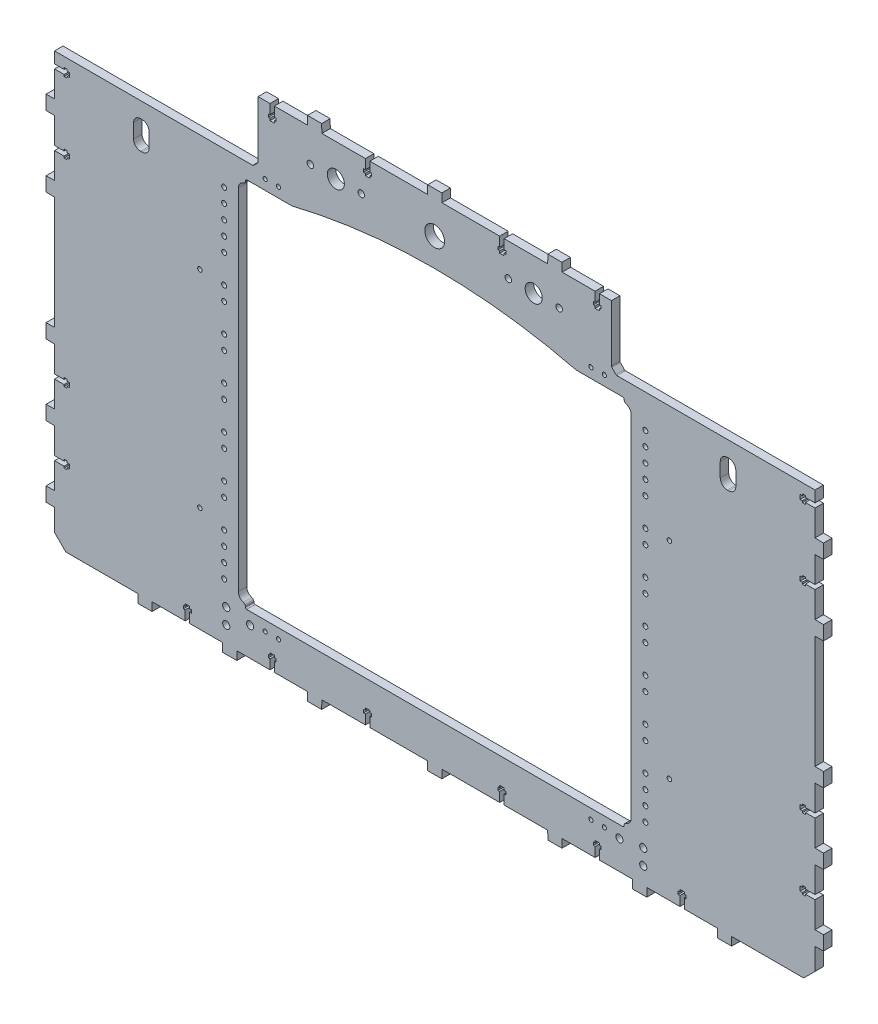
from build123d import *

# Parameters (mm, degrees)
SKETCH_1_R      = 1.6
SKETCH_1_R_2    = 1.75
SKETCH_1_R_3    = 2.55
SKETCH_1_R_4    = 1.5
SKETCH_1_R_5    = 2.3
SKETCH_1_R_6    = 6.05
SKETCH_1_R_7    = 7
EXTRUDE_1_DEPTH = 6


with BuildPart() as part:
    # Эскиз1 → Бобышка-Вытянуть1 (new body)
    with BuildSketch(Plane.XY):
        with BuildLine():
            Line((1433.580450761, 343.057239019), (1435.080450761, 343.057239019))
            Line((1435.080450761, 343.057239019), (1435.080450761, 339.95723902))
            Line((1435.080450761, 339.95723902), (1433.580450761, 339.95723902))
            Line((1433.580450761, 339.95723902), (1433.580450761, 338.75723902))
            Line((1433.580450761, 338.75723902), (1431.380450761, 338.75723902))
            Line((1431.380450761, 338.75723902), (1431.380450761, 339.95723902))
            Line((1431.380450761, 339.95723902), (1424.580450761, 339.95723902))
            Line((1424.580450761, 339.95723902), (1424.580450761, 321.60723902))
            Line((1424.580450761, 321.60723902), (1418.580450762, 321.50723902))
            Line((1418.580450762, 321.50723902), (1418.580450762, 311.50723902))
            Line((1418.580450762, 311.50723902), (1424.580450761, 311.407239019))
            Line((1424.580450761, 311.407239019), (1424.580450761, 293.05723902))
            Line((1424.580450761, 293.05723902), (1431.380450761, 293.05723902))
            Line((1431.380450761, 293.05723902), (1431.380450761, 294.25723902))
            Line((1431.380450761, 294.25723902), (1433.580450761, 294.25723902))
            Line((1433.580450761, 294.25723902), (1433.580450761, 293.05723902))
            Line((1433.580450761, 293.05723902), (1435.080450761, 293.05723902))
            Line((1435.080450761, 293.05723902), (1435.080450761, 289.95723902))
            Line((1435.080450761, 289.95723902), (1433.580450761, 289.95723902))
            Line((1433.580450761, 289.95723902), (1433.580450761, 288.75723902))
            Line((1433.580450761, 288.75723902), (1431.380450761, 288.75723902))
            Line((1431.380450761, 288.75723902), (1431.380450761, 289.95723902))
            Line((1431.380450761, 289.95723902), (1424.580450761, 289.95723902))
            Line((1424.580450761, 289.95723902), (1424.580450761, 271.60723902))
            Line((1424.580450761, 271.60723902), (1418.580450762, 271.50723902))
            Line((1418.580450762, 271.50723902), (1418.580450762, 261.50723902))
            Line((1418.580450762, 261.50723902), (1424.580450761, 261.407239019))
            Line((1424.580450761, 261.407239019), (1424.580450761, 181.60723902))
            Line((1424.580450761, 181.60723902), (1418.580450762, 181.50723902))
            Line((1418.580450762, 181.50723902), (1418.580450762, 171.50723902))
            Line((1418.580450762, 171.50723902), (1424.58045076, 171.407239019))
            Line((1424.58045076, 171.407239019), (1424.58045076, 153.05723902))
            Line((1424.58045076, 153.05723902), (1431.38045076, 153.05723902))
            Line((1431.38045076, 153.05723902), (1431.38045076, 154.257239019))
            Line((1431.38045076, 154.257239019), (1433.58045076, 154.257239019))
            Line((1433.58045076, 154.257239019), (1433.58045076, 153.057239019))
            Line((1433.58045076, 153.057239019), (1435.08045076, 153.057239019))
            Line((1435.08045076, 153.057239019), (1435.08045076, 149.957239019))
            Line((1435.08045076, 149.957239019), (1433.58045076, 149.957239019))
            Line((1433.58045076, 149.957239019), (1433.58045076, 148.757239019))
            Line((1433.58045076, 148.757239019), (1431.38045076, 148.757239019))
            Line((1431.38045076, 148.757239019), (1431.38045076, 149.957239019))
            Line((1431.38045076, 149.957239019), (1424.58045076, 149.957239019))
            Line((1424.58045076, 149.957239019), (1424.58045076, 131.607239019))
            Line((1424.58045076, 131.607239019), (1418.580450762, 131.507239019))
            Line((1418.580450762, 131.507239019), (1418.580450762, 121.507239019))
            Line((1418.580450762, 121.507239019), (1424.58045076, 121.407239018))
            Line((1424.58045076, 121.407239018), (1424.58045076, 103.057239019))
            Line((1424.58045076, 103.057239019), (1431.38045076, 103.057239019))
            Line((1431.38045076, 103.057239019), (1431.38045076, 104.257239019))
            Line((1431.38045076, 104.257239019), (1433.58045076, 104.257239019))
            Line((1433.58045076, 104.257239019), (1433.58045076, 103.057239019))
            Line((1433.58045076, 103.057239019), (1435.08045076, 103.057239019))
            Line((1435.08045076, 103.057239019), (1435.08045076, 99.957239019))
            Line((1435.08045076, 99.957239019), (1433.58045076, 99.957239019))
            Line((1433.58045076, 99.957239019), (1433.58045076, 98.757239019))
            Line((1433.58045076, 98.757239019), (1431.38045076, 98.757239019))
            Line((1431.38045076, 98.757239019), (1431.38045076, 99.957239019))
            Line((1431.38045076, 99.957239019), (1424.58045076, 99.957239019))
            Line((1424.58045076, 99.957239019), (1424.58045076, 81.607239019))
            Line((1424.58045076, 81.607239019), (1418.580450762, 81.507239019))
            Line((1418.580450762, 81.507239019), (1418.580450762, 71.507239019))
            Line((1418.580450762, 71.507239019), (1424.58045076, 71.407239018))
            Line((1424.58045076, 71.407239018), (1424.58045076, 56.007239019))
            Line((1424.58045076, 56.007239019), (1432.58045076, 48.007239019))
            Line((1432.58045076, 48.007239019), (1483.480450759, 48.007239019))
            Line((1483.480450759, 48.007239019), (1483.58045076, 42.00723902))
            Line((1483.58045076, 42.00723902), (1493.58045076, 42.00723902))
            Line((1493.58045076, 42.00723902), (1493.68045076, 48.007239019))
            Line((1493.68045076, 48.007239019), (1517.03045076, 48.007239019))
            Line((1517.03045076, 48.007239019), (1517.03045076, 54.807239019))
            Line((1517.03045076, 54.807239019), (1515.830450761, 54.807239019))
            Line((1515.830450761, 54.807239019), (1515.830450761, 57.007239019))
            Line((1515.830450761, 57.007239019), (1517.030450761, 57.007239019))
            Line((1517.030450761, 57.007239019), (1517.030450761, 58.507239019))
            Line((1517.030450761, 58.507239019), (1520.130450761, 58.507239019))
            Line((1520.130450761, 58.507239019), (1520.130450761, 57.007239019))
            Line((1520.130450761, 57.007239019), (1521.330450761, 57.007239019))
            Line((1521.330450761, 57.007239019), (1521.330450761, 54.807239019))
            Line((1521.330450761, 54.807239019), (1520.130450761, 54.807239019))
            Line((1520.130450761, 54.807239019), (1520.130450761, 48.007239019))
            Line((1520.130450761, 48.007239019), (1532.58045076, 48.007239019))
            Line((1532.58045076, 48.007239019), (1543.48045076, 48.007239019))
            Line((1543.48045076, 48.007239019), (1543.580450761, 42.00723902))
            Line((1543.580450761, 42.00723902), (1553.580450761, 42.00723902))
            Line((1553.580450761, 42.00723902), (1553.680450761, 48.007239018))
            Line((1553.680450761, 48.007239018), (1577.030450761, 48.007239018))
            Line((1577.030450761, 48.007239018), (1577.030450761, 54.807239018))
            Line((1577.030450761, 54.807239018), (1575.830450761, 54.807239018))
            Line((1575.830450761, 54.807239018), (1575.830450761, 57.007239018))
            Line((1575.830450761, 57.007239018), (1577.030450761, 57.007239018))
            Line((1577.030450761, 57.007239018), (1577.030450761, 58.507239018))
            Line((1577.030450761, 58.507239018), (1580.130450761, 58.507239018))
            Line((1580.130450761, 58.507239018), (1580.130450761, 57.007239018))
            Line((1580.130450761, 57.007239018), (1581.330450761, 57.007239018))
            Line((1581.330450761, 57.007239018), (1581.330450761, 54.807239018))
            Line((1581.330450761, 54.807239018), (1580.130450761, 54.807239018))
            Line((1580.130450761, 54.807239018), (1580.130450761, 48.007239018))
            Line((1580.130450761, 48.007239018), (1603.48045076, 48.007239018))
            Line((1603.48045076, 48.007239018), (1603.580450761, 42.007239019))
            Line((1603.580450761, 42.007239019), (1613.580450761, 42.007239019))
            Line((1613.580450761, 42.007239019), (1613.680450761, 48.007239017))
            Line((1613.680450761, 48.007239017), (1644.530450761, 48.007239017))
            Line((1644.530450761, 48.007239017), (1644.530450761, 54.807239017))
            Line((1644.530450761, 54.807239017), (1643.330450762, 54.807239017))
            Line((1643.330450762, 54.807239017), (1643.330450762, 57.007239017))
            Line((1643.330450762, 57.007239017), (1644.530450762, 57.007239017))
            Line((1644.530450762, 57.007239017), (1644.530450762, 58.507239017))
            Line((1644.530450762, 58.507239017), (1647.630450762, 58.507239017))
            Line((1647.630450762, 58.507239017), (1647.630450762, 57.007239017))
            Line((1647.630450762, 57.007239017), (1648.830450762, 57.007239017))
            Line((1648.830450762, 57.007239017), (1648.830450762, 54.807239017))
            Line((1648.830450762, 54.807239017), (1647.630450762, 54.807239017))
            Line((1647.630450762, 54.807239017), (1647.630450762, 48.007239017))
            Line((1647.630450762, 48.007239017), (1688.480450762, 48.007239017))
            Line((1688.480450762, 48.007239017), (1688.580450762, 42.007239019))
            Line((1688.580450762, 42.007239019), (1698.580450762, 42.007239019))
            Line((1698.580450762, 42.007239019), (1698.680450762, 48.007239017))
            Line((1698.680450762, 48.007239017), (1739.530450762, 48.007239017))
            Line((1739.530450762, 48.007239017), (1739.530450762, 54.807239017))
            Line((1739.530450762, 54.807239017), (1738.330450762, 54.807239017))
            Line((1738.330450762, 54.807239017), (1738.330450762, 57.007239017))
            Line((1738.330450762, 57.007239017), (1739.530450762, 57.007239017))
            Line((1739.530450762, 57.007239017), (1739.530450762, 58.507239017))
            Line((1739.530450762, 58.507239017), (1742.630450762, 58.507239017))
            Line((1742.630450762, 58.507239017), (1742.630450762, 57.007239017))
            Line((1742.630450762, 57.007239017), (1743.830450762, 57.007239017))
            Line((1743.830450762, 57.007239017), (1743.830450762, 54.807239017))
            Line((1743.830450762, 54.807239017), (1742.630450762, 54.807239017))
            Line((1742.630450762, 54.807239017), (1742.630450762, 48.007239017))
            Line((1742.630450762, 48.007239017), (1773.480450762, 48.007239017))
            Line((1773.480450762, 48.007239017), (1773.580450762, 42.007239018))
            Line((1773.580450762, 42.007239018), (1783.580450762, 42.007239018))
            Line((1783.580450762, 42.007239018), (1783.680450762, 48.007239017))
            Line((1783.680450762, 48.007239017), (1807.030450762, 48.007239017))
            Line((1807.030450762, 48.007239017), (1807.030450762, 54.807239017))
            Line((1807.030450762, 54.807239017), (1805.830450762, 54.807239017))
            Line((1805.830450762, 54.807239017), (1805.830450762, 57.007239017))
            Line((1805.830450762, 57.007239017), (1807.030450762, 57.007239017))
            Line((1807.030450762, 57.007239017), (1807.030450762, 58.507239017))
            Line((1807.030450762, 58.507239017), (1810.130450762, 58.507239017))
            Line((1810.130450762, 58.507239017), (1810.130450762, 57.007239017))
            Line((1810.130450762, 57.007239017), (1811.330450762, 57.007239017))
            Line((1811.330450762, 57.007239017), (1811.330450762, 54.807239017))
            Line((1811.330450762, 54.807239017), (1810.130450762, 54.807239017))
            Line((1810.130450762, 54.807239017), (1810.130450762, 48.007239017))
            Line((1810.130450762, 48.007239017), (1833.480450762, 48.007239017))
            Line((1833.480450762, 48.007239017), (1833.580450762, 42.007239018))
            Line((1833.580450762, 42.007239018), (1843.580450762, 42.007239018))
            Line((1843.580450762, 42.007239018), (1843.680450762, 48.007239017))
            Line((1843.680450762, 48.007239017), (1854.580450762, 48.007239017))
            Line((1854.580450762, 48.007239017), (1867.030450762, 48.007239017))
            Line((1867.030450762, 48.007239017), (1867.030450762, 54.807239017))
            Line((1867.030450762, 54.807239017), (1865.830450762, 54.807239017))
            Line((1865.830450762, 54.807239017), (1865.830450762, 57.007239017))
            Line((1865.830450762, 57.007239017), (1867.030450762, 57.007239017))
            Line((1867.030450762, 57.007239017), (1867.030450762, 58.507239017))
            Line((1867.030450762, 58.507239017), (1870.130450762, 58.507239017))
            Line((1870.130450762, 58.507239017), (1870.130450762, 57.007239017))
            Line((1870.130450762, 57.007239017), (1871.330450762, 57.007239017))
            Line((1871.330450762, 57.007239017), (1871.330450762, 54.807239017))
            Line((1871.330450762, 54.807239017), (1870.130450762, 54.807239017))
            Line((1870.130450762, 54.807239017), (1870.130450762, 48.007239017))
            Line((1870.130450762, 48.007239017), (1893.480450762, 48.007239017))
            Line((1893.480450762, 48.007239017), (1893.580450762, 42.007239018))
            Line((1893.580450762, 42.007239018), (1903.580450762, 42.007239018))
            Line((1903.580450762, 42.007239018), (1903.680450762, 48.007239017))
            Line((1903.680450762, 48.007239017), (1954.580450762, 48.007239017))
            Line((1954.580450762, 48.007239017), (1962.580450762, 56.007239017))
            Line((1962.580450762, 56.007239017), (1962.580450762, 71.407239016))
            Line((1962.580450762, 71.407239016), (1968.58045076, 71.507239016))
            Line((1968.58045076, 71.507239016), (1968.58045076, 81.507239016))
            Line((1968.58045076, 81.507239016), (1962.580450762, 81.607239016))
            Line((1962.580450762, 81.607239016), (1962.580450762, 99.957239016))
            Line((1962.580450762, 99.957239016), (1955.780450762, 99.957239016))
            Line((1955.780450762, 99.957239016), (1955.780450762, 98.757239016))
            Line((1955.780450762, 98.757239016), (1953.580450762, 98.757239016))
            Line((1953.580450762, 98.757239016), (1953.580450762, 99.957239016))
            Line((1953.580450762, 99.957239016), (1952.080450762, 99.957239016))
            Line((1952.080450762, 99.957239016), (1952.080450762, 103.057239016))
            Line((1952.080450762, 103.057239016), (1953.580450762, 103.057239016))
            Line((1953.580450762, 103.057239016), (1953.580450762, 104.257239016))
            Line((1953.580450762, 104.257239016), (1955.780450762, 104.257239016))
            Line((1955.780450762, 104.257239016), (1955.780450762, 103.057239016))
            Line((1955.780450762, 103.057239016), (1962.580450762, 103.057239016))
            Line((1962.580450762, 103.057239016), (1962.580450762, 121.407239016))
            Line((1962.580450762, 121.407239016), (1968.58045076, 121.507239016))
            Line((1968.58045076, 121.507239016), (1968.58045076, 131.507239016))
            Line((1968.58045076, 131.507239016), (1962.580450762, 131.607239016))
            Line((1962.580450762, 131.607239016), (1962.580450762, 149.957239016))
            Line((1962.580450762, 149.957239016), (1955.780450762, 149.957239016))
            Line((1955.780450762, 149.957239016), (1955.780450762, 148.757239016))
            Line((1955.780450762, 148.757239016), (1953.580450762, 148.757239016))
            Line((1953.580450762, 148.757239016), (1953.580450762, 149.957239016))
            Line((1953.580450762, 149.957239016), (1952.080450762, 149.957239016))
            Line((1952.080450762, 149.957239016), (1952.080450762, 153.057239016))
            Line((1952.080450762, 153.057239016), (1953.580450762, 153.057239016))
            Line((1953.580450762, 153.057239016), (1953.580450762, 154.257239016))
            Line((1953.580450762, 154.257239016), (1955.780450762, 154.257239016))
            Line((1955.780450762, 154.257239016), (1955.780450762, 153.057239016))
            Line((1955.780450762, 153.057239016), (1962.580450762, 153.057239016))
            Line((1962.580450762, 153.057239016), (1962.580450762, 171.407239016))
            Line((1962.580450762, 171.407239016), (1968.58045076, 171.507239016))
            Line((1968.58045076, 171.507239016), (1968.58045076, 181.507239016))
            Line((1968.58045076, 181.507239016), (1962.580450762, 181.607239016))
            Line((1962.580450762, 181.607239016), (1962.580450762, 261.407239016))
            Line((1962.580450762, 261.407239016), (1968.58045076, 261.507239017))
            Line((1968.58045076, 261.507239017), (1968.58045076, 271.507239017))
            Line((1968.58045076, 271.507239017), (1962.580450762, 271.607239017))
            Line((1962.580450762, 271.607239017), (1962.580450762, 289.957239017))
            Line((1962.580450762, 289.957239017), (1955.780450762, 289.957239017))
            Line((1955.780450762, 289.957239017), (1955.780450762, 288.757239017))
            Line((1955.780450762, 288.757239017), (1953.580450762, 288.757239017))
            Line((1953.580450762, 288.757239017), (1953.580450762, 289.957239017))
            Line((1953.580450762, 289.957239017), (1952.080450762, 289.957239017))
            Line((1952.080450762, 289.957239017), (1952.080450762, 293.057239017))
            Line((1952.080450762, 293.057239017), (1953.580450762, 293.057239017))
            Line((1953.580450762, 293.057239017), (1953.580450762, 294.257239017))
            Line((1953.580450762, 294.257239017), (1955.780450762, 294.257239017))
            Line((1955.780450762, 294.257239017), (1955.780450762, 293.057239017))
            Line((1955.780450762, 293.057239017), (1962.580450762, 293.057239017))
            Line((1962.580450762, 293.057239017), (1962.580450762, 311.407239016))
            Line((1962.580450762, 311.407239016), (1968.58045076, 311.507239017))
            Line((1968.58045076, 311.507239017), (1968.58045076, 321.507239017))
            Line((1968.58045076, 321.507239017), (1962.580450762, 321.607239017))
            Line((1962.580450762, 321.607239017), (1962.580450762, 339.957239017))
            Line((1962.580450762, 339.957239017), (1955.780450762, 339.957239017))
            Line((1955.780450762, 339.957239017), (1955.780450762, 338.757239018))
            Line((1955.780450762, 338.757239018), (1953.580450762, 338.757239018))
            Line((1953.580450762, 338.757239018), (1953.580450762, 339.957239018))
            Line((1953.580450762, 339.957239018), (1952.080450762, 339.957239018))
            Line((1952.080450762, 339.957239018), (1952.080450762, 343.057239018))
            Line((1952.080450762, 343.057239018), (1953.580450762, 343.057239018))
            Line((1953.580450762, 343.057239018), (1953.580450762, 344.257239018))
            Line((1953.580450762, 344.257239018), (1955.780450762, 344.257239018))
            Line((1955.780450762, 344.257239018), (1955.780450762, 343.057239018))
            Line((1955.780450762, 343.057239018), (1962.580450762, 343.057239018))
            Line((1962.580450762, 343.057239018), (1962.580450762, 351.007239019))
            Line((1962.580450762, 351.007239019), (1862.580450762, 351.007239019))
            Line((1862.580450762, 351.007239019), (1822.494664324, 351.007239019))
            ThreePointArc((1822.494664324, 351.007239019), (1822.111980892, 351.083359486), (1821.787557543, 351.300132238))
            Line((1821.787557543, 351.300132238), (1818.87334398, 354.2143458))
            ThreePointArc((1818.87334398, 354.2143458), (1818.656571229, 354.538769149), (1818.580450762, 354.921452581))
            Line((1818.580450762, 354.921452581), (1818.580450762, 395.007239019))
            Line((1818.580450762, 395.007239019), (1810.130450762, 395.007239019))
            Line((1810.130450762, 395.007239019), (1810.130450762, 388.207239019))
            Line((1810.130450762, 388.207239019), (1811.330450761, 388.207239019))
            Line((1811.330450761, 388.207239019), (1811.330450761, 386.007239019))
            Line((1811.330450761, 386.007239019), (1810.130450761, 386.007239019))
            Line((1810.130450761, 386.007239019), (1810.130450761, 384.507239019))
            Line((1810.130450761, 384.507239019), (1807.030450761, 384.507239019))
            Line((1807.030450761, 384.507239019), (1807.030450761, 386.007239019))
            Line((1807.030450761, 386.007239019), (1805.830450761, 386.007239019))
            Line((1805.830450761, 386.007239019), (1805.830450761, 388.207239019))
            Line((1805.830450761, 388.207239019), (1807.030450761, 388.207239019))
            Line((1807.030450761, 388.207239019), (1807.030450761, 395.007239019))
            Line((1807.030450761, 395.007239019), (1783.680450762, 395.007239019))
            Line((1783.680450762, 395.007239019), (1783.580450761, 401.007239017))
            Line((1783.580450761, 401.007239017), (1773.580450761, 401.007239017))
            Line((1773.580450761, 401.007239017), (1773.480450761, 395.007239019))
            Line((1773.480450761, 395.007239019), (1742.630450761, 395.007239019))
            Line((1742.630450761, 395.007239019), (1742.630450761, 388.207239019))
            Line((1742.630450761, 388.207239019), (1743.83045076, 388.207239019))
            Line((1743.83045076, 388.207239019), (1743.83045076, 386.007239019))
            Line((1743.83045076, 386.007239019), (1742.63045076, 386.007239019))
            Line((1742.63045076, 386.007239019), (1742.63045076, 384.507239019))
            Line((1742.63045076, 384.507239019), (1739.53045076, 384.507239019))
            Line((1739.53045076, 384.507239019), (1739.53045076, 386.007239019))
            Line((1739.53045076, 386.007239019), (1738.33045076, 386.007239019))
            Line((1738.33045076, 386.007239019), (1738.33045076, 388.207239019))
            Line((1738.33045076, 388.207239019), (1739.53045076, 388.207239019))
            Line((1739.53045076, 388.207239019), (1739.53045076, 395.007239019))
            Line((1739.53045076, 395.007239019), (1698.680450761, 395.007239019))
            Line((1698.680450761, 395.007239019), (1698.58045076, 401.007239017))
            Line((1698.58045076, 401.007239017), (1688.58045076, 401.007239017))
            Line((1688.58045076, 401.007239017), (1688.48045076, 395.007239019))
            Line((1688.48045076, 395.007239019), (1647.63045076, 395.007239019))
            Line((1647.63045076, 395.007239019), (1647.63045076, 388.207239019))
            Line((1647.63045076, 388.207239019), (1648.83045076, 388.207239019))
            Line((1648.83045076, 388.207239019), (1648.83045076, 386.007239019))
            Line((1648.83045076, 386.007239019), (1647.63045076, 386.007239019))
            Line((1647.63045076, 386.007239019), (1647.63045076, 384.507239019))
            Line((1647.63045076, 384.507239019), (1644.53045076, 384.507239019))
            Line((1644.53045076, 384.507239019), (1644.53045076, 386.007239019))
            Line((1644.53045076, 386.007239019), (1643.33045076, 386.007239019))
            Line((1643.33045076, 386.007239019), (1643.33045076, 388.207239019))
            Line((1643.33045076, 388.207239019), (1644.53045076, 388.207239019))
            Line((1644.53045076, 388.207239019), (1644.53045076, 395.007239019))
            Line((1644.53045076, 395.007239019), (1613.680450761, 395.007239019))
            Line((1613.680450761, 395.007239019), (1613.58045076, 401.007239017))
            Line((1613.58045076, 401.007239017), (1603.58045076, 401.007239017))
            Line((1603.58045076, 401.007239017), (1603.48045076, 395.007239019))
            Line((1603.48045076, 395.007239019), (1580.13045076, 395.007239019))
            Line((1580.13045076, 395.007239019), (1580.13045076, 388.207239019))
            Line((1580.13045076, 388.207239019), (1581.33045076, 388.207239019))
            Line((1581.33045076, 388.207239019), (1581.33045076, 386.007239019))
            Line((1581.33045076, 386.007239019), (1580.13045076, 386.007239019))
            Line((1580.13045076, 386.007239019), (1580.13045076, 384.507239019))
            Line((1580.13045076, 384.507239019), (1577.03045076, 384.507239019))
            Line((1577.03045076, 384.507239019), (1577.03045076, 386.007239019))
            Line((1577.03045076, 386.007239019), (1575.83045076, 386.007239019))
            Line((1575.83045076, 386.007239019), (1575.83045076, 388.207239019))
            Line((1575.83045076, 388.207239019), (1577.03045076, 388.207239019))
            Line((1577.03045076, 388.207239019), (1577.03045076, 395.007239019))
            Line((1577.03045076, 395.007239019), (1568.58045076, 395.007239019))
            Line((1568.58045076, 395.007239019), (1568.58045076, 354.921452581))
            ThreePointArc((1568.58045076, 354.921452581), (1568.504330293, 354.538769149), (1568.287557541, 354.2143458))
            Line((1568.287557541, 354.2143458), (1565.373343979, 351.300132238))
            ThreePointArc((1565.373343979, 351.300132238), (1565.04892063, 351.083359486), (1564.666237198, 351.007239019))
            Line((1564.666237198, 351.007239019), (1524.58045076, 351.007239019))
            Line((1524.58045076, 351.007239019), (1424.580450761, 351.007239019))
            Line((1424.580450761, 351.007239019), (1424.580450761, 343.057239019))
            Line((1424.580450761, 343.057239019), (1431.380450761, 343.057239019))
            Line((1431.380450761, 343.057239019), (1431.380450761, 344.257239019))
            Line((1431.380450761, 344.257239019), (1433.580450761, 344.257239019))
            Line((1433.580450761, 344.257239019), (1433.580450761, 343.057239019))
        make_face()
        with Locations((1859.58045076, 268.557239017)):
            Circle(SKETCH_1_R, mode=Mode.SUBTRACT)
        with Locations((1859.58045076, 122.557239017)):
            Circle(SKETCH_1_R, mode=Mode.SUBTRACT)
        with Locations((1527.442189288, 268.557239017)):
            Circle(SKETCH_1_R, mode=Mode.SUBTRACT)
        with Locations((1527.442189288, 122.557239017)):
            Circle(SKETCH_1_R, mode=Mode.SUBTRACT)
        with Locations((1544.58045076, 177.507239237)):
            Circle(SKETCH_1_R_2, mode=Mode.SUBTRACT)
        with Locations((1544.58045076, 147.507239237)):
            Circle(SKETCH_1_R_2, mode=Mode.SUBTRACT)
        with Locations((1544.58045076, 137.507239237)):
            Circle(SKETCH_1_R_2, mode=Mode.SUBTRACT)
        with Locations((1544.58045076, 117.507239237)):
            Circle(SKETCH_1_R_2, mode=Mode.SUBTRACT)
        with Locations((1544.58045076, 107.507239237)):
            Circle(SKETCH_1_R_2, mode=Mode.SUBTRACT)
        with Locations((1544.58045076, 97.507239237)):
            Circle(SKETCH_1_R_2, mode=Mode.SUBTRACT)
        with Locations((1544.58045076, 87.507239237)):
            Circle(SKETCH_1_R_2, mode=Mode.SUBTRACT)
        with Locations((1546.08045076, 71.007239019)):
            Circle(SKETCH_1_R_3, mode=Mode.SUBTRACT)
        with Locations((1546.08045076, 60.007239019)):
            Circle(SKETCH_1_R_3, mode=Mode.SUBTRACT)
        with Locations((1544.58045076, 197.507239237)):
            Circle(SKETCH_1_R_2, mode=Mode.SUBTRACT)
        with Locations((1544.58045076, 207.507239237)):
            Circle(SKETCH_1_R_2, mode=Mode.SUBTRACT)
        with Locations((1544.58045076, 227.507239237)):
            Circle(SKETCH_1_R_2, mode=Mode.SUBTRACT)
        with Locations((1544.58045076, 237.507239237)):
            Circle(SKETCH_1_R_2, mode=Mode.SUBTRACT)
        with Locations((1544.58045076, 257.507239237)):
            Circle(SKETCH_1_R_2, mode=Mode.SUBTRACT)
        with Locations((1544.58045076, 267.507239237)):
            Circle(SKETCH_1_R_2, mode=Mode.SUBTRACT)
        with Locations((1544.58045076, 287.507239237)):
            Circle(SKETCH_1_R_2, mode=Mode.SUBTRACT)
        with Locations((1544.58045076, 297.507239237)):
            Circle(SKETCH_1_R_2, mode=Mode.SUBTRACT)
        with Locations((1544.58045076, 307.507239237)):
            Circle(SKETCH_1_R_2, mode=Mode.SUBTRACT)
        with Locations((1544.58045076, 317.507239237)):
            Circle(SKETCH_1_R_2, mode=Mode.SUBTRACT)
        with Locations((1544.58045076, 327.507239237)):
            Circle(SKETCH_1_R_2, mode=Mode.SUBTRACT)
        with Locations((1573.58045076, 347.007239019)):
            Circle(SKETCH_1_R_4, mode=Mode.SUBTRACT)
        with Locations((1583.08045076, 347.007239019)):
            Circle(SKETCH_1_R_4, mode=Mode.SUBTRACT)
        with Locations((1605.58045076, 372.007239019)):
            Circle(SKETCH_1_R_5, mode=Mode.SUBTRACT)
        with Locations((1623.58045076, 372.007239019)):
            Circle(SKETCH_1_R_6, mode=Mode.SUBTRACT)
        with Locations((1641.58045076, 372.007239019)):
            Circle(SKETCH_1_R_5, mode=Mode.SUBTRACT)
        with Locations((1693.511320024, 372.007239019)):
            Circle(SKETCH_1_R_7, mode=Mode.SUBTRACT)
        with Locations((1745.58045076, 372.007239019)):
            Circle(SKETCH_1_R_5, mode=Mode.SUBTRACT)
        with Locations((1763.58045076, 372.007239019)):
            Circle(SKETCH_1_R_6, mode=Mode.SUBTRACT)
        with Locations((1781.58045076, 372.007239019)):
            Circle(SKETCH_1_R_5, mode=Mode.SUBTRACT)
        with Locations((1804.08045076, 347.007239019)):
            Circle(SKETCH_1_R_4, mode=Mode.SUBTRACT)
        with Locations((1813.58045076, 347.007239019)):
            Circle(SKETCH_1_R_4, mode=Mode.SUBTRACT)
        with Locations((1842.58045076, 327.507239019)):
            Circle(SKETCH_1_R_2, mode=Mode.SUBTRACT)
        with Locations((1842.58045076, 317.507239019)):
            Circle(SKETCH_1_R_2, mode=Mode.SUBTRACT)
        with Locations((1842.58045076, 307.507239019)):
            Circle(SKETCH_1_R_2, mode=Mode.SUBTRACT)
        with Locations((1842.58045076, 297.507239019)):
            Circle(SKETCH_1_R_2, mode=Mode.SUBTRACT)
        with Locations((1842.58045076, 287.507239019)):
            Circle(SKETCH_1_R_2, mode=Mode.SUBTRACT)
        with Locations((1842.58045076, 267.507239019)):
            Circle(SKETCH_1_R_2, mode=Mode.SUBTRACT)
        with Locations((1842.58045076, 257.507239019)):
            Circle(SKETCH_1_R_2, mode=Mode.SUBTRACT)
        with Locations((1842.58045076, 237.507239019)):
            Circle(SKETCH_1_R_2, mode=Mode.SUBTRACT)
        with Locations((1842.58045076, 227.507239019)):
            Circle(SKETCH_1_R_2, mode=Mode.SUBTRACT)
        with Locations((1842.58045076, 207.507239019)):
            Circle(SKETCH_1_R_2, mode=Mode.SUBTRACT)
        with Locations((1842.58045076, 197.507239019)):
            Circle(SKETCH_1_R_2, mode=Mode.SUBTRACT)
        with Locations((1842.58045076, 177.507239019)):
            Circle(SKETCH_1_R_2, mode=Mode.SUBTRACT)
        with Locations((1842.58045076, 167.507239019)):
            Circle(SKETCH_1_R_2, mode=Mode.SUBTRACT)
        with Locations((1842.58045076, 147.507239019)):
            Circle(SKETCH_1_R_2, mode=Mode.SUBTRACT)
        with Locations((1842.58045076, 137.507239019)):
            Circle(SKETCH_1_R_2, mode=Mode.SUBTRACT)
        with Locations((1842.58045076, 117.507239019)):
            Circle(SKETCH_1_R_2, mode=Mode.SUBTRACT)
        with Locations((1842.58045076, 107.507239019)):
            Circle(SKETCH_1_R_2, mode=Mode.SUBTRACT)
        with Locations((1842.58045076, 97.507239019)):
            Circle(SKETCH_1_R_2, mode=Mode.SUBTRACT)
        with Locations((1842.58045076, 87.507239019)):
            Circle(SKETCH_1_R_2, mode=Mode.SUBTRACT)
        with Locations((1841.08045076, 71.007239019)):
            Circle(SKETCH_1_R_3, mode=Mode.SUBTRACT)
        with Locations((1841.08045076, 60.007239019)):
            Circle(SKETCH_1_R_3, mode=Mode.SUBTRACT)
        with Locations((1824.227659727, 68.296772665)):
            Circle(SKETCH_1_R_3, mode=Mode.SUBTRACT)
        with Locations((1813.58045076, 69.78654025)):
            Circle(SKETCH_1_R_4, mode=Mode.SUBTRACT)
        with Locations((1804.08045076, 69.78654025)):
            Circle(SKETCH_1_R_4, mode=Mode.SUBTRACT)
        with Locations((1583.08045076, 69.78654025)):
            Circle(SKETCH_1_R_4, mode=Mode.SUBTRACT)
        with Locations((1573.58045076, 69.78654025)):
            Circle(SKETCH_1_R_4, mode=Mode.SUBTRACT)
        with Locations((1562.93045076, 68.296772665)):
            Circle(SKETCH_1_R_3, mode=Mode.SUBTRACT)
        with Locations((1544.58045076, 167.507239237)):
            Circle(SKETCH_1_R_2, mode=Mode.SUBTRACT)
        with BuildLine():
            Line((1560.58045076, 76.78654025), (1826.579713792, 76.78654025))
            ThreePointArc((1826.579713792, 76.78654025), (1827.286820573, 77.079433469), (1827.579713792, 77.78654025))
            Line((1827.579713792, 77.78654025), (1827.579713792, 78.078336318))
            ThreePointArc((1827.579713792, 78.078336318), (1827.976146341, 79.273564927), (1829.008285221, 79.994966013))
            ThreePointArc((1829.008285221, 79.994966013), (1831.588627971, 81.798462757), (1832.579713792, 84.786525358))
            Line((1832.579713792, 84.786525358), (1832.580467982, 332.007224127))
            ThreePointArc((1832.580467982, 332.007224127), (1831.589391061, 334.995304572), (1829.009039411, 336.798813257))
            ThreePointArc((1829.009039411, 336.798813257), (1827.976900531, 337.520214342), (1827.580467982, 338.715442951))
            Line((1827.580467982, 338.715442951), (1827.580467982, 339.007239019))
            ThreePointArc((1827.580467982, 339.007239019), (1827.287574764, 339.7143458), (1826.580467982, 340.007239019))
            Line((1826.580467982, 340.007239019), (1793.680450761, 340.007239019))
            ThreePointArc((1793.680450761, 340.007239019), (1693.122117427, 352.15701974), (1592.563784093, 340.007239019))
            Line((1592.563784093, 340.007239019), (1560.58045076, 340.007239019))
            ThreePointArc((1560.58045076, 340.007239019), (1559.873343979, 339.7143458), (1559.58045076, 339.007239019))
            Line((1559.58045076, 339.007239019), (1559.58045076, 338.715442951))
            ThreePointArc((1559.58045076, 338.715442951), (1559.184018212, 337.520214342), (1558.151879332, 336.798813256))
            ThreePointArc((1558.151879332, 336.798813256), (1555.571532132, 334.995310542), (1554.58045076, 332.007239019))
            Line((1554.58045076, 332.007239019), (1554.58045076, 84.78654025))
            ThreePointArc((1554.58045076, 84.78654025), (1555.571532132, 81.798468727), (1558.151879332, 79.994966012))
            ThreePointArc((1558.151879332, 79.994966012), (1559.184018212, 79.273564927), (1559.58045076, 78.078336317))
            Line((1559.58045076, 78.078336317), (1559.58045076, 77.78654025))
            ThreePointArc((1559.58045076, 77.78654025), (1559.873343979, 77.079433469), (1560.58045076, 76.78654025))
        make_face(mode=Mode.SUBTRACT)
        with BuildLine():
            Line((1900.540471295, 339.95723902), (1901.540471295, 339.95723902))
            ThreePointArc((1901.540471295, 339.95723902), (1905.0760052, 338.492772926), (1906.540471295, 334.95723902))
            Line((1906.540471295, 334.95723902), (1906.540471295, 324.95723902))
            ThreePointArc((1906.540471295, 324.95723902), (1905.0760052, 321.421705114), (1901.540471295, 319.95723902))
            Line((1901.540471295, 319.95723902), (1900.540471295, 319.95723902))
            ThreePointArc((1900.540471295, 319.95723902), (1897.004937389, 321.421705114), (1895.540471295, 324.95723902))
            Line((1895.540471295, 324.95723902), (1895.540471295, 334.95723902))
            ThreePointArc((1895.540471295, 334.95723902), (1897.004937389, 338.492772926), (1900.540471295, 339.95723902))
        make_face(mode=Mode.SUBTRACT)
        with BuildLine():
            Line((1486.482168754, 319.95723902), (1485.482168754, 319.95723902))
            ThreePointArc((1485.482168754, 319.95723902), (1481.946634848, 321.421705114), (1480.482168754, 324.95723902))
            Line((1480.482168754, 324.95723902), (1480.482168754, 334.95723902))
            ThreePointArc((1480.482168754, 334.95723902), (1481.946634848, 338.492772926), (1485.482168754, 339.95723902))
            Line((1485.482168754, 339.95723902), (1486.482168754, 339.95723902))
            ThreePointArc((1486.482168754, 339.95723902), (1490.01770266, 338.492772926), (1491.482168754, 334.95723902))
            Line((1491.482168754, 334.95723902), (1491.482168754, 324.95723902))
            ThreePointArc((1491.482168754, 324.95723902), (1490.01770266, 321.421705114), (1486.482168754, 319.95723902))
        make_face(mode=Mode.SUBTRACT)
    extrude(amount=EXTRUDE_1_DEPTH)


solid = part.part
